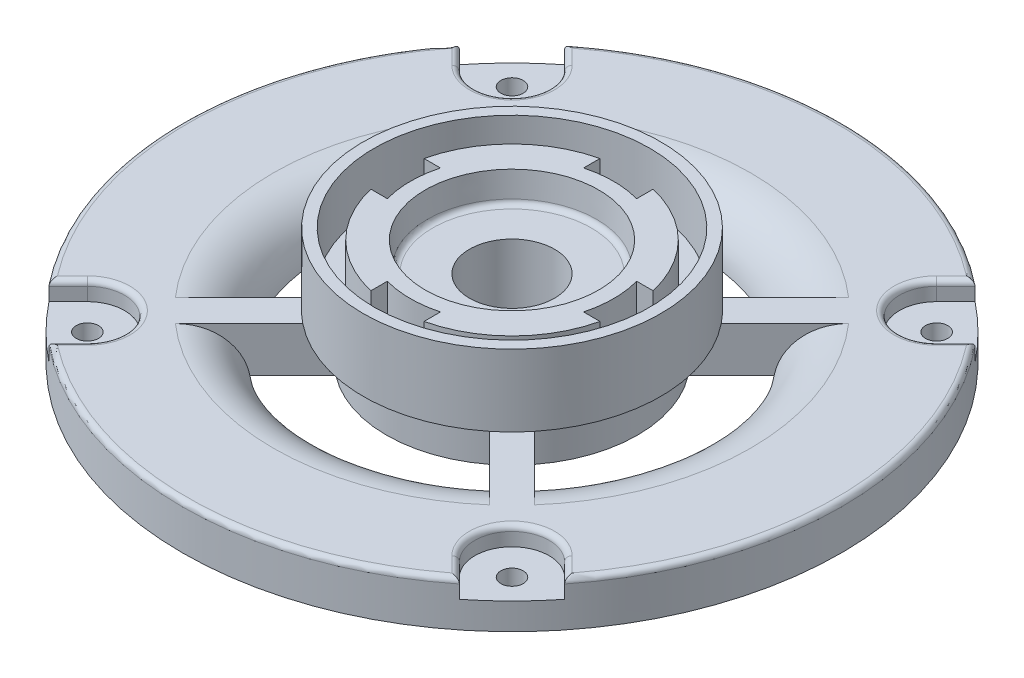
from build123d import *

# Parameters (mm, degrees)
SKETCH_1_R            = 62
SKETCH_1_R_2          = 35
EXTRUDE_1_DEPTH       = 8.5
FILLET_1_R            = 10
EXTRUDE_2_DEPTH       = 8.5
SKETCH_3_R            = 28
EXTRUDE_3_DEPTH       = 13.5
SKETCH_4_R            = 16.5
CUT_EXTRUDE_1_DEPTH   = 7.5
CUT_EXTRUDE_1_DRAFT   = -5
FILLET_2_R            = 1
CHAMFER_1_SIZE        = 1
CHAMFER_1_SIZE2       = 1.100062868
SKETCH_5_R            = 8
CUT_EXTRUDE_2_DEPTH   = 89.872099125
SKETCH_6_R            = 25.925
CUT_EXTRUDE_3_DEPTH   = 10
SKETCH_8_R            = 24
CUT_EXTRUDE_4_DEPTH   = 2
CUT_EXTRUDE_START     = -3.5
CUT_EXTRUDE_5_DEPTH   = 3.5
FILLET_3_R            = 1
HOLE_WIZARD_M51_D     = 4.2
HOLE_WIZARD_M51_DEPTH = 14
HOLE_WIZARD_M51_TIP   = 1.2618073


with BuildPart() as part:
    # Эскиз1 → Бобышка-Вытянуть1 (new body)
    with BuildSketch(Plane(origin=(0, 0, 0), x_dir=(1, 0, 0), z_dir=(0, 1, 0))):
        with Locations(Location((0, 0, 0), (0, 0, 270))):
            Circle(SKETCH_1_R)
        with Locations(Location((0, 0, 0), (0, 0, 270))):
            Circle(SKETCH_1_R_2, mode=Mode.SUBTRACT)
    extrude(amount=EXTRUDE_1_DEPTH)

    # Скругление1
    # the kernel refuses this fillet: 10 mm, written as the material it takes off along each edge
    with BuildSketch(Plane(origin=(0, 8.5, 0), x_dir=(0, 0, 1), z_dir=(-1, 0, 0))) as fillet_1_piece_1:
        with BuildLine():
            CenterArc((44.886859967, -10), FILLET_1_R, 90, 81.373073441)
            Line((44.886859967, 0), (44.886859967, 0.2))
            Line((44.886859967, 0.2), (35, 0.2))
            Line((35, 0.2), (34.8, 0))
            ThreePointArc((34.8, 0), (34.8, -4.25), (34.802262801, -8.47))
            Line((34.802262801, -8.47), (35, -8.5))
        make_face()
    revolve(axis=Axis((0, 8.5, 0), (0, 1, 0)), mode=Mode.SUBTRACT)

    # Эскиз2 → Бобышка-Вытянуть2 (add)
    with BuildSketch(Plane(origin=(0, 8.5, 0), x_dir=(1, 0, 0), z_dir=(0, 1, 0))):
        with BuildLine():
            Line((-14.448842978, 18.691483665), (-29.547514476, 33.790155163))
            ThreePointArc((-29.547514476, 33.790155163), (-31.739803069, 31.739803069), (-33.790155163, 29.547514476))
            Line((-33.790155163, 29.547514476), (-18.691483665, 14.448842978))
            ThreePointArc((-18.691483665, 14.448842978), (-23.625, 0), (-18.691483665, -14.448842978))
            Line((-18.691483665, -14.448842978), (-33.790155163, -29.547514476))
            ThreePointArc((-33.790155163, -29.547514476), (-31.739803069, -31.739803069), (-29.547514476, -33.790155163))
            Line((-29.547514476, -33.790155163), (-14.448842978, -18.691483665))
            ThreePointArc((-14.448842978, -18.691483665), (0, -23.625), (14.448842978, -18.691483665))
            Line((14.448842978, -18.691483665), (29.547514476, -33.790155163))
            ThreePointArc((29.547514476, -33.790155163), (31.739803069, -31.739803069), (33.790155163, -29.547514476))
            Line((33.790155163, -29.547514476), (18.691483665, -14.448842978))
            ThreePointArc((18.691483665, -14.448842978), (23.625, 0), (18.691483665, 14.448842978))
            Line((18.691483665, 14.448842978), (33.790155163, 29.547514476))
            ThreePointArc((33.790155163, 29.547514476), (31.739803069, 31.739803069), (29.547514476, 33.790155163))
            Line((29.547514476, 33.790155163), (14.448842978, 18.691483665))
            ThreePointArc((14.448842978, 18.691483665), (0, 23.625), (-14.448842978, 18.691483665))
        make_face()
    extrude(amount=-EXTRUDE_2_DEPTH)

    # Эскиз3 → Бобышка-Вытянуть3 (add)
    with BuildSketch(Plane(origin=(0, 8.5, 0), x_dir=(1, 0, 0), z_dir=(0, 1, 0))):
        with Locations(Location((0, 0, 0), (0, 0, 51.150639828))):
            Circle(SKETCH_3_R)
    extrude(amount=EXTRUDE_3_DEPTH)


with BuildPart() as cut_extrude_1_tool:
    # Эскиз4 → Вырез-Вытянуть1 (with draft: the straight prism first)
    with BuildSketch(Plane(origin=(0, 22, 0), x_dir=(1, 0, 0), z_dir=(0, 1, 0))):
        Circle(SKETCH_4_R)
    extrude(amount=-CUT_EXTRUDE_1_DEPTH)
    # Вырез-Вытянуть1: the draft: its side faces are tilted about the plane it starts from
    cut_extrude_1_sides = [cut_extrude_1_tool.faces().sort_by_distance(p)[0] for p in [
        (-16.5, 18.25, 0),
    ]]
    draft(cut_extrude_1_sides, Plane(origin=(0, 22, 0), x_dir=(1, 0, 0), z_dir=(0, 1, 0)), CUT_EXTRUDE_1_DRAFT)


with BuildPart() as part_1:
    add(part.part)

    # Вырез-Вытянуть1: cut by cut_extrude_1_tool
    add(cut_extrude_1_tool.part, mode=Mode.SUBTRACT)

    # Скругление2
    fillet_2_edges = [part_1.edges().sort_by_distance(p)[0] for p in [
        (-15.843835024, 14.5, 0),
    ]]
    fillet(fillet_2_edges, radius=FILLET_2_R)

    # Фаска1
    chamfer_1_edges = [part_1.edges().sort_by_distance(p)[0] for p in [
        (-16.5, 22, 0),
    ]]
    chamfer_1_side = [part_1.faces().sort_by_distance(p)[0] for p in [
        (-17.066922905, 22, 21.189563592),
    ]]
    chamfer(chamfer_1_edges, length=CHAMFER_1_SIZE, length2=CHAMFER_1_SIZE2, reference=chamfer_1_side[0])

    # Эскиз5 → Вырез-Вытянуть2 (cut, through all)
    with BuildSketch(Plane(origin=(0, 14.5, 0), x_dir=(1, 0, 0), z_dir=(0, 1, 0))):
        with Locations(Location((0, 0, 0), (0, 0, 270))):
            Circle(SKETCH_5_R)
    extrude(amount=-CUT_EXTRUDE_2_DEPTH, mode=Mode.SUBTRACT)

    # Эскиз6 → Вырез-Вытянуть3 (cut)
    with BuildSketch(Plane(origin=(0, 22, 0), x_dir=(1, 0, 0), z_dir=(0, 1, 0))):
        with Locations(Location((0, 0, 0), (0, 0, 270))):
            Circle(SKETCH_6_R)
        with BuildLine():
            Line((-21.55262455, -5), (-18.459838163, -5))
            ThreePointArc((-18.459838163, -5), (-19.125, 0), (-18.459838163, 5))
            Line((-18.459838163, 5), (-21.55262455, 5))
            ThreePointArc((-21.55262455, 5), (-15.644737534, 15.644737534), (-5, 21.55262455))
            Line((-5, 21.55262455), (-5, 18.459838163))
            ThreePointArc((-5, 18.459838163), (0, 19.125), (5, 18.459838163))
            Line((5, 18.459838163), (5, 21.55262455))
            ThreePointArc((5, 21.55262455), (15.644737534, 15.644737534), (21.55262455, 5))
            Line((21.55262455, 5), (18.459838163, 5))
            ThreePointArc((18.459838163, 5), (19.125, 0), (18.459838163, -5))
            Line((18.459838163, -5), (21.55262455, -5))
            ThreePointArc((21.55262455, -5), (15.644737534, -15.644737534), (5, -21.55262455))
            Line((5, -21.55262455), (5, -18.459838163))
            ThreePointArc((5, -18.459838163), (0, -19.125), (-5, -18.459838163))
            Line((-5, -18.459838163), (-5, -21.55262455))
            ThreePointArc((-5, -21.55262455), (-15.644737534, -15.644737534), (-21.55262455, -5))
        make_face(mode=Mode.SUBTRACT)
    extrude(amount=-CUT_EXTRUDE_3_DEPTH, mode=Mode.SUBTRACT)

    # Эскиз8 → Вырез-Вытянуть4 (cut)
    with BuildSketch(Plane(origin=(0, 22, 0), x_dir=(1, 0, 0), z_dir=(0, 1, 0))):
        Circle(SKETCH_8_R)
    extrude(amount=-CUT_EXTRUDE_4_DEPTH, mode=Mode.SUBTRACT)

    # Эскиз9 → Вырез-Вытянуть5 (cut)
    with BuildSketch(Plane(origin=(0, 8.5, 0), x_dir=(1, 0, 0), z_dir=(0, 1, 0)).offset(CUT_EXTRUDE_START)):
        with BuildLine():
            Line((38.610555561, 48.510050498), (35.001785669, 44.901280605))
            ThreePointArc((35.001785669, 44.901280605), (35.001785669, 35.001785669), (44.901280605, 35.001785669))
            Line((44.901280605, 35.001785669), (48.510050498, 38.610555561))
            ThreePointArc((48.510050498, 38.610555561), (43.840620434, 43.840620434), (38.610555561, 48.510050498))
        make_face()
        with BuildLine():
            Line((-38.610555561, 48.510050498), (-35.001785669, 44.901280605))
            ThreePointArc((-35.001785669, 44.901280605), (-35.001785669, 35.001785669), (-44.901280605, 35.001785669))
            Line((-44.901280605, 35.001785669), (-48.510050498, 38.610555561))
            ThreePointArc((-48.510050498, 38.610555561), (-43.840620434, 43.840620434), (-38.610555561, 48.510050498))
        make_face()
        with BuildLine():
            Line((48.510050498, -38.610555561), (44.901280605, -35.001785669))
            ThreePointArc((44.901280605, -35.001785669), (35.001785669, -35.001785669), (35.001785669, -44.901280605))
            Line((35.001785669, -44.901280605), (38.610555561, -48.510050498))
            ThreePointArc((38.610555561, -48.510050498), (43.840620434, -43.840620434), (48.510050498, -38.610555561))
        make_face()
        with BuildLine():
            Line((-38.610555561, -48.510050498), (-35.001785669, -44.901280605))
            ThreePointArc((-35.001785669, -44.901280605), (-35.001785669, -35.001785669), (-44.901280605, -35.001785669))
            Line((-44.901280605, -35.001785669), (-48.510050498, -38.610555561))
            ThreePointArc((-48.510050498, -38.610555561), (-43.840620434, -43.840620434), (-38.610555561, -48.510050498))
        make_face()
    extrude(amount=CUT_EXTRUDE_5_DEPTH, mode=Mode.SUBTRACT)

    # Скругление3
    fillet_3_edges = [part_1.edges().sort_by_distance(p)[0] for p in [
        (62, 8.5, 0),
        (0, 8.5, -62),
        (-62, 8.5, 0),
        (-20.449656099, 8.5, 58.530432814),
        (-36.806170615, 8.5, 46.705665551),
        (-35.001785669, 8.5, 35.001785669),
        (-46.705665551, 8.5, 36.806170615),
        (46.705665551, 8.5, 36.806170615),
        (35.001785669, 8.5, 35.001785669),
        (36.806170615, 8.5, 46.705665551),
        (36.806170615, 8.5, -46.705665551),
        (35.001785669, 8.5, -35.001785669),
        (46.705665551, 8.5, -36.806170615),
        (-46.705665551, 8.5, -36.806170615),
        (-35.001785669, 8.5, -35.001785669),
        (-36.806170615, 8.5, -46.705665551),
    ]]
    fillet(fillet_3_edges, radius=FILLET_3_R)

    # Отверстие обработанное метчиком M51
    with Locations(Plane(origin=(0, 5, 0), x_dir=(1, 0, 0), z_dir=(0, 1, 0))):
        with Locations((-39.951533137, 39.951533137), (39.951533137, 39.951533137), (39.951533137, -39.951533137), (-39.951533137, -39.951533137)):
            Hole(HOLE_WIZARD_M51_D / 2, depth=HOLE_WIZARD_M51_DEPTH)
            with Locations((0, 0, -(HOLE_WIZARD_M51_DEPTH + HOLE_WIZARD_M51_TIP / 2))):  # 118° drill point
                Cone(0, HOLE_WIZARD_M51_D / 2, HOLE_WIZARD_M51_TIP, mode=Mode.SUBTRACT)


solid = part_1.part
